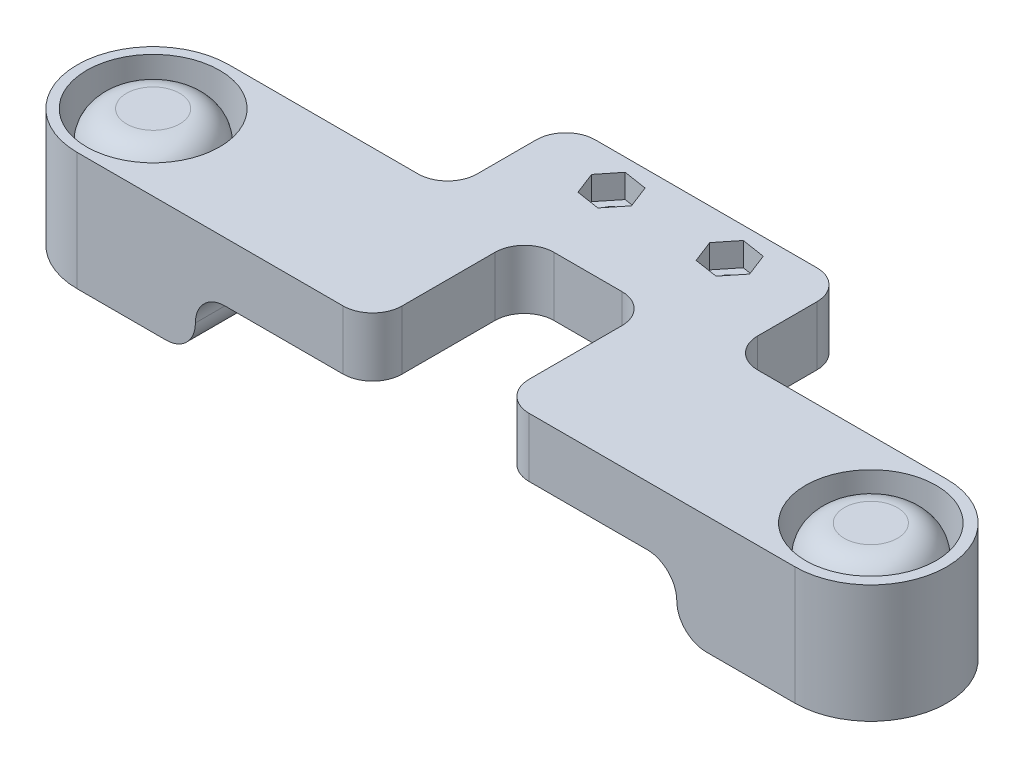
from build123d import *

# Parameters (mm, degrees)
SKETCH1_R           = 11.25
SKETCH1_R_2         = 11.05
BOSS_EXTRUDE1_DEPTH = 20
BOSS_EXTRUDE2_DEPTH = 2
SKETCH3_R           = 9.5
BOSS_EXTRUDE3_DEPTH = 18
SKETCH4_W           = 81.5
SKETCH4_H           = 10
CUT_EXTRUDE1_DEPTH  = 47
FILLET1_START       = -12
FILLET1_DEPTH       = 28
FILLET1_START_2     = -10.55574922
FILLET1_2_DEPTH     = 25.7
SKETCH5_W           = 47.5
SKETCH5_H           = 10
BOSS_EXTRUDE4_DEPTH = 20
FILLET2_R           = 5
SKETCH6_W           = 21.5
SKETCH6_H           = 25.70672576
CUT_EXTRUDE2_DEPTH  = 20
FILLET3_R           = 5
SKETCH7_R           = 2.25
CUT_EXTRUDE3_DEPTH  = 20
CUT_EXTRUDE4_DEPTH  = 4
FILLET4_R           = 5
FILLET5_R           = 5


with BuildPart() as part:
    # Sketch1 → Boss-Extrude1 (new body)
    with BuildSketch(Plane(origin=(0, 0, 0), x_dir=(1, 0, 0), z_dir=(0, 1, 0))):
        with BuildLine():
            Line((98.181049616, -15.14425078), (-23.318950384, -15.14425078))
            ThreePointArc((-23.318950384, -15.14425078), (-36.168950384, -2.29425078), (-23.318950384, 10.55574922))
            Line((-23.318950384, 10.55574922), (98.181049616, 10.55574922))
            ThreePointArc((98.181049616, 10.55574922), (111.031049616, -2.29425078), (98.181049616, -15.14425078))
        make_face()
        with Locations(Location((-23.318950384, -2.29425078, 0), (0, 0, 270))):
            Circle(SKETCH1_R, mode=Mode.SUBTRACT)
        with Locations(Location((98.181049616, -2.29425078, 0), (0, 0, 270))):
            Circle(SKETCH1_R_2, mode=Mode.SUBTRACT)
    extrude(amount=BOSS_EXTRUDE1_DEPTH)

    # Sketch2 → Boss-Extrude2 (add)
    with BuildSketch(Plane.XZ):
        with BuildLine():
            Line((-23.318950384, -10.55574922), (98.181049616, -10.55574922))
            ThreePointArc((98.181049616, -10.55574922), (111.031049616, 2.29425078), (98.181049616, 15.14425078))
            Line((98.181049616, 15.14425078), (-23.318950384, 15.14425078))
            ThreePointArc((-23.318950384, 15.14425078), (-36.168950384, 2.29425078), (-23.318950384, -10.55574922))
        make_face()
    extrude(amount=-BOSS_EXTRUDE2_DEPTH)

    # Sketch3 → Boss-Extrude3 (add)
    with BuildSketch(Plane(origin=(0, 2, 0), x_dir=(1, 0, 0), z_dir=(0, 1, 0))):
        with Locations(Location((-23.318950384, -2.29425078, 0), (0, 0, 90))):
            Circle(SKETCH3_R)
        with Locations(Location((98.181049616, -2.29425078, 0), (0, 0, 90))):
            Circle(SKETCH3_R)
    extrude(amount=BOSS_EXTRUDE3_DEPTH)

    # Sketch4 → Cut-Extrude1 (cut)
    with BuildSketch(Plane(origin=(0, 0, -10.55574922), x_dir=(-1, 0, 0), z_dir=(0, 0, -1))):
        with Locations((-37.431049616, 5)):
            Rectangle(SKETCH4_W, SKETCH4_H)
    extrude(amount=-CUT_EXTRUDE1_DEPTH, mode=Mode.SUBTRACT)

    # Fillet1: read off the stored shape, not the designer's step
    # Fillet1 outline → Fillet1 (cut)
    with BuildSketch(Plane.XY.offset(FILLET1_START)):
        with BuildLine():
            Line((-3.318950384, 0), (-3.318950384, 5))
            ThreePointArc((-3.318950384, 5), (-4.783416479, 1.464466094), (-8.318950384, 0))
            Line((-8.318950384, 0), (-3.318950384, 0))
        make_face()
        with BuildLine():
            ThreePointArc((83.181049616, 0), (79.64551571, 1.464466094), (78.181049616, 5))
            Line((78.181049616, 5), (78.181049616, 0))
            Line((78.181049616, 0), (83.181049616, 0))
        make_face()
    extrude(amount=FILLET1_DEPTH, mode=Mode.SUBTRACT)

    # Fillet1 2 outline → Fillet1 2 (add)
    with BuildSketch(Plane.XY.offset(FILLET1_START_2)):
        with BuildLine():
            Line((78.181049616, 10), (73.181049616, 10))
            ThreePointArc((73.181049616, 10), (76.716583521, 8.535533906), (78.181049616, 5))
            Line((78.181049616, 5), (78.181049616, 10))
        make_face()
        with BuildLine():
            ThreePointArc((-3.318950384, 5), (-1.85448429, 8.535533906), (1.681049616, 10))
            Line((1.681049616, 10), (-3.318950384, 10))
            Line((-3.318950384, 10), (-3.318950384, 5))
        make_face()
    extrude(amount=FILLET1_2_DEPTH)

    # Sketch5 → Boss-Extrude4 (add)
    with BuildSketch(Plane(origin=(0, 0, -10.55574922), x_dir=(-1, 0, 0), z_dir=(0, 0, -1))):
        with Locations((-37.431049616, 15)):
            Rectangle(SKETCH5_W, SKETCH5_H)
    extrude(amount=BOSS_EXTRUDE4_DEPTH)

    # Fillet2
    fillet2_edges = [part.edges().sort_by_distance(p)[0] for p in [
        (13.681049616, 15, -10.55574922),
        (61.181049616, 15, -10.55574922),
        (13.681049616, 15, -30.55574922),
        (61.181049616, 15, -30.55574922),
    ]]
    fillet(fillet2_edges, radius=FILLET2_R)

    # Sketch6 → Cut-Extrude2 (cut)
    with BuildSketch(Plane(origin=(0, 10, 0), x_dir=(-1, 0, 0), z_dir=(0, -1, 0))):
        with Locations((-37.431049616, -2.2908879)):
            Rectangle(SKETCH6_W, SKETCH6_H)
    extrude(amount=-CUT_EXTRUDE2_DEPTH, mode=Mode.SUBTRACT)

    # Fillet3
    fillet3_edges = [part.edges().sort_by_distance(p)[0] for p in [
        (26.681049616, 15, -10.56247498),
        (26.681049616, 15, 15.14425078),
        (48.181049616, 15, 15.14425078),
        (48.181049616, 15, -10.56247498),
    ]]
    fillet(fillet3_edges, radius=FILLET3_R)

    # Sketch7 → Cut-Extrude3 (cut)
    with BuildSketch(Plane(origin=(0, 10, 0), x_dir=(-1, 0, 0), z_dir=(0, -1, 0))):
        with Locations(Location((-27.431049616, 24.55574922, 0), (0, 0, 180))):
            Circle(SKETCH7_R)
        with Locations(Location((-47.431049616, 24.55574922, 0), (0, 0, 180))):
            Circle(SKETCH7_R)
    extrude(amount=-CUT_EXTRUDE3_DEPTH, mode=Mode.SUBTRACT)

    # Sketch8 → Cut-Extrude4 (cut)
    with BuildSketch(Plane(origin=(0, 20, 0), x_dir=(1, 0, 0), z_dir=(0, 1, 0))):
        Polygon((31.424828925, 23.936830678), (29.963938451, 27.705004288), (25.970159141, 28.32392283), (23.437270306, 25.174667762), (24.898160781, 21.406494152), (28.89194009, 20.78757561), align=None)
        Polygon((51.424828925, 23.936830678), (49.963938451, 27.705004288), (45.970159141, 28.32392283), (43.437270306, 25.174667762), (44.898160781, 21.406494152), (48.89194009, 20.78757561), align=None)
    extrude(amount=-CUT_EXTRUDE4_DEPTH, mode=Mode.SUBTRACT)

    # Fillet4
    fillet4_edges = [part.edges().sort_by_distance(p)[0] for p in [
        (-23.318950384, 20, 11.79425078),
    ]]
    fillet(fillet4_edges, radius=FILLET4_R)

    # Fillet5
    fillet5_edges = [part.edges().sort_by_distance(p)[0] for p in [
        (98.181049616, 20, 11.79425078),
    ]]
    fillet(fillet5_edges, radius=FILLET5_R)


solid = part.part
